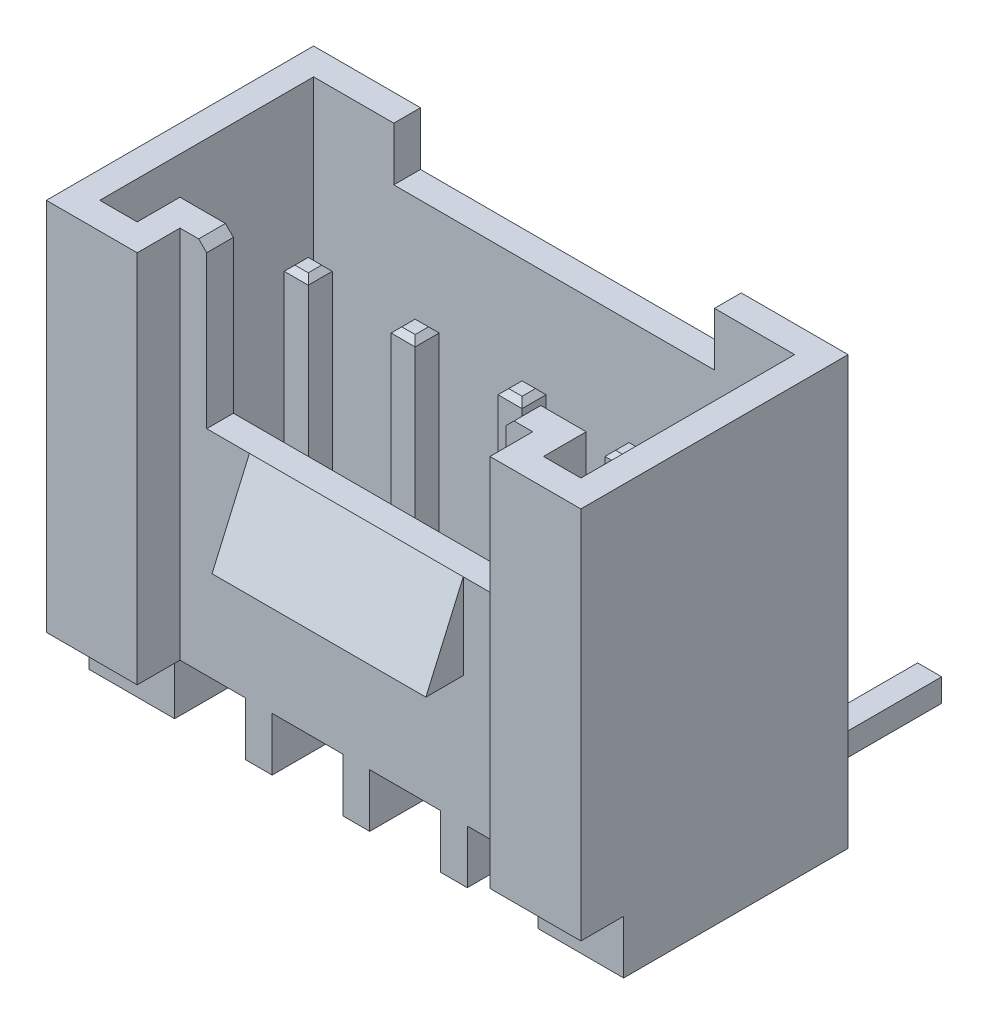
from build123d import *

# Parameters (mm, degrees)
ESQUISSE1_W             = 10
ESQUISSE1_H             = 5
BOSS_EXTRU_1_DEPTH      = 8
ESQUISSE2_W             = 6.6
ESQUISSE2_H             = 0.8
ENL_V_MAT_EXTRU_1_DEPTH = 8
ENL_V_MAT_EXTRU_2_DEPTH = 6.5
ESQUISSE5_W             = 6
ESQUISSE5_H             = 0.5
ENL_V_MAT_EXTRU_3_DEPTH = 1
ESQUISSE6_W             = 5.6
ESQUISSE6_H             = 0.5
ENL_V_MAT_EXTRU_4_DEPTH = 3
ESQUISSE7_W             = 0.8
ESQUISSE7_H             = 1
ENL_V_MAT_EXTRU_5_DEPTH = 10
ESQUISSE8_W             = 6.8
ESQUISSE8_H             = 4.2
ENL_V_MAT_EXTRU_6_DEPTH = 1
BOSS_EXTRU_2_DEPTH      = 6.8
BOSS_EXTRU_3_DEPTH      = 2
BOSS_EXTRU_3_DEPTH_BACK = 2
ESQUISSE12_W            = 0.5
ESQUISSE12_H            = 4.2
BOSS_EXTRU_4_DEPTH      = 1
CHANFREIN1_SIZE         = 0.15
BOSS_EXTRU_5_DEPTH      = 0.5
BOSS_EXTRU_5_DEPTH_BACK = 6.3
ESQUISSE13_W            = 0.45
ESQUISSE13_H            = 0.45
ESQUISSE14_W            = 0.45
ESQUISSE14_H            = 0.43
BOSS_EXTRU_6_DEPTH      = 5.5
CONG_1_R                = 0.1
CHANFREIN2_SIZE         = 0.1


with BuildPart() as part:
    # Esquisse1 → Boss.-Extru.1 (new body)
    with BuildSketch(Plane(origin=(0, 0, 0), x_dir=(1, 0, 0), z_dir=(0, 1, 0))):
        with Locations((5, 2.5)):
            Rectangle(ESQUISSE1_W, ESQUISSE1_H)
    extrude(amount=BOSS_EXTRU_1_DEPTH)

    # Esquisse2 → Enlèv. mat.-Extru.1 (cut)
    with BuildSketch(Plane(origin=(0, 8, 0), x_dir=(1, 0, 0), z_dir=(0, 1, 0))):
        with Locations((5, 0.4)):
            Rectangle(ESQUISSE2_W, ESQUISSE2_H)
    extrude(amount=-ENL_V_MAT_EXTRU_1_DEPTH, mode=Mode.SUBTRACT)

    # Esquisse4 → Enlèv. mat.-Extru.2 (cut)
    with BuildSketch(Plane(origin=(0, 8, 0), x_dir=(1, 0, 0), z_dir=(0, 1, 0))):
        Polygon((0.5, 0.5), (1.2, 0.5), (1.2, 1.3), (8.8, 1.3), (8.8, 0.5), (9.5, 0.5), (9.5, 4.5), (0.5, 4.5), align=None)
    extrude(amount=-ENL_V_MAT_EXTRU_2_DEPTH, mode=Mode.SUBTRACT)

    # Esquisse5 → Enlèv. mat.-Extru.3 (cut)
    with BuildSketch(Plane(origin=(0, 8, 0), x_dir=(1, 0, 0), z_dir=(0, 1, 0))):
        with Locations((5, 4.75)):
            Rectangle(ESQUISSE5_W, ESQUISSE5_H)
    extrude(amount=-ENL_V_MAT_EXTRU_3_DEPTH, mode=Mode.SUBTRACT)

    # Esquisse6 → Enlèv. mat.-Extru.4 (cut)
    with BuildSketch(Plane(origin=(0, 8, 0), x_dir=(1, 0, 0), z_dir=(0, 1, 0))):
        with Locations((5, 1.05)):
            Rectangle(ESQUISSE6_W, ESQUISSE6_H)
    extrude(amount=-ENL_V_MAT_EXTRU_4_DEPTH, mode=Mode.SUBTRACT)

    # Esquisse7 → Enlèv. mat.-Extru.5 (cut)
    with BuildSketch(Plane(origin=(10, 0, 0), x_dir=(0, 0, -1), z_dir=(1, 0, 0))):
        with Locations((0.4, 0.5)):
            Rectangle(ESQUISSE7_W, ESQUISSE7_H)
    extrude(amount=-ENL_V_MAT_EXTRU_5_DEPTH, mode=Mode.SUBTRACT)

    # Esquisse8 → Enlèv. mat.-Extru.6 (cut)
    with BuildSketch(Plane.XZ):
        with Locations((5, -2.9)):
            Rectangle(ESQUISSE8_W, ESQUISSE8_H)
    extrude(amount=-ENL_V_MAT_EXTRU_6_DEPTH, mode=Mode.SUBTRACT)

    # Esquisse9 → Boss.-Extru.2 (add)
    with BuildSketch(Plane(origin=(1.6, 0, 0), x_dir=(0, 0, -1), z_dir=(1, 0, 0))):
        Polygon((4.7, 1), (3.9, 0.2), (1.9, 0.2), (1.1, 1), align=None)
    extrude(amount=BOSS_EXTRU_2_DEPTH)

    # Esquisse11 → Boss.-Extru.3 (add, two sides: drawn at the far end of the back side and taken through both)
    with BuildSketch(Plane(origin=(5, 0, 0), x_dir=(0, 0, -1), z_dir=(1, 0, 0)).offset(-BOSS_EXTRU_3_DEPTH_BACK)):
        Polygon((0.8, 5), (0.1, 3.4), (0.8, 3.4), align=None)
    extrude(amount=BOSS_EXTRU_3_DEPTH + BOSS_EXTRU_3_DEPTH_BACK)

    # Esquisse12 → Boss.-Extru.4 (add)
    with BuildSketch(Plane(origin=(0, 1, 0), x_dir=(1, 0, 0), z_dir=(0, 1, 0))):
        with Locations((5, 2.9)):
            Rectangle(ESQUISSE12_W, ESQUISSE12_H)
        with Locations((3.175, 2.9)):
            Rectangle(ESQUISSE12_W, ESQUISSE12_H)
        with Locations((6.825, 2.9)):
            Rectangle(ESQUISSE12_W, ESQUISSE12_H)
    extrude(amount=-BOSS_EXTRU_4_DEPTH)

    # Chanfrein1
    chanfrein1_edges = [part.edges().sort_by_distance(p)[0] for p in [
        (2.2, 8, -1.05),
        (7.8, 8, -1.05),
    ]]
    chamfer(chanfrein1_edges, length=CHANFREIN1_SIZE)

    # Esquisse13 → Boss.-Extru.5 (add, two sides: drawn at the far end of the back side and taken through both)
    with BuildSketch(Plane.XZ.offset(-0.2).offset(-BOSS_EXTRU_5_DEPTH_BACK)):
        with Locations((4, -2.9)):
            Rectangle(ESQUISSE13_W, ESQUISSE13_H)
        with Locations((2, -2.9)):
            Rectangle(ESQUISSE13_W, ESQUISSE13_H)
        with Locations((8, -2.9)):
            Rectangle(ESQUISSE13_W, ESQUISSE13_H)
        with Locations((6, -2.9)):
            Rectangle(ESQUISSE13_W, ESQUISSE13_H)
    extrude(amount=BOSS_EXTRU_5_DEPTH + BOSS_EXTRU_5_DEPTH_BACK)

    # Esquisse14 → Boss.-Extru.6 (add)
    with BuildSketch(Plane(origin=(0, 0, -3.125), x_dir=(-1, 0, 0), z_dir=(0, 0, -1))):
        with Locations((-8, -0.085)):
            Rectangle(ESQUISSE14_W, ESQUISSE14_H)
        with Locations((-6, -0.085)):
            Rectangle(ESQUISSE14_W, ESQUISSE14_H)
        with Locations((-4, -0.085)):
            Rectangle(ESQUISSE14_W, ESQUISSE14_H)
        with Locations((-2, -0.085)):
            Rectangle(ESQUISSE14_W, ESQUISSE14_H)
    extrude(amount=BOSS_EXTRU_6_DEPTH)

    # Congé1
    # the kernel refuses this fillet: 0.1 mm, written as the material it adds along each edge
    with BuildSketch(Plane(origin=(7.775, 0.13, -3.125), x_dir=(0, 1, 0), z_dir=(1, 0, 0)), Plane(origin=(5.775, 0.13, -3.125), x_dir=(0, 1, 0), z_dir=(1, 0, 0))) as cong_1_piece_1:
        with BuildLine():
            CenterArc((0.1, -0.09539392), CONG_1_R, 107.457603124, 72.542396876)
            Line((0, -0.09539392), (0, 0))
            Line((0, 0), (0.07, 0))
        make_face()
    extrude(amount=0.45)
    with BuildSketch(Plane(origin=(3.775, 0.13, -3.125), x_dir=(0, 0, -1), z_dir=(1, 0, 0)), Plane(origin=(1.775, 0.13, -3.125), x_dir=(0, 0, -1), z_dir=(1, 0, 0))) as cong_1_piece_2:
        with BuildLine():
            CenterArc((0.09539392, 0.1), CONG_1_R, 197.457603124, 72.542396876)
            Line((0, 0.07), (0, 0))
            Line((0, 0), (0.09539392, 0))
        make_face()
    extrude(amount=0.45)
    # the kernel refuses this fillet: 0.1 mm, written as the material it takes off along each edge
    with BuildSketch(Plane(origin=(3.525, -0.3, -2.675), x_dir=(0, 1, 0), z_dir=(1, 0, 0)), Plane(origin=(1.525, -0.3, -2.675), x_dir=(0, 1, 0), z_dir=(1, 0, 0))) as cong_1_2_piece_1:
        with BuildLine():
            CenterArc((CONG_1_R, -CONG_1_R), CONG_1_R, 90, 90)
            Line((0, -CONG_1_R), (0, 0))
            Line((0, 0), (CONG_1_R, 0))
        make_face()
    extrude(amount=0.95, mode=Mode.SUBTRACT)
    with BuildSketch(Plane(origin=(8.475, -0.3, -2.675), x_dir=(0, 1, 0), z_dir=(-1, 0, 0)), Plane(origin=(6.475, -0.3, -2.675), x_dir=(0, 1, 0), z_dir=(-1, 0, 0))) as cong_1_2_piece_2:
        with BuildLine():
            CenterArc((CONG_1_R, CONG_1_R), CONG_1_R, 180, 90)
            Line((0, CONG_1_R), (0, 0))
            Line((0, 0), (CONG_1_R, 0))
        make_face()
    extrude(amount=0.95, mode=Mode.SUBTRACT)

    # Chanfrein2
    chanfrein2_edges = [part.edges().sort_by_distance(p)[0] for p in [
        (4.225, 6.5, -2.9),
        (4, 6.5, -3.125),
        (3.775, 6.5, -2.9),
        (4, 6.5, -2.675),
        (2.225, 6.5, -2.9),
        (2, 6.5, -3.125),
        (1.775, 6.5, -2.9),
        (2, 6.5, -2.675),
        (7.775, 6.5, -2.9),
        (8, 6.5, -2.675),
        (8.225, 6.5, -2.9),
        (8, 6.5, -3.125),
        (5.775, 6.5, -2.9),
        (6, 6.5, -2.675),
        (6.225, 6.5, -2.9),
        (6, 6.5, -3.125),
        (8.225, -0.085, -8.625),
        (8, -0.3, -8.625),
        (7.775, -0.085, -8.625),
        (8, 0.13, -8.625),
        (6.225, -0.085, -8.625),
        (6, -0.3, -8.625),
        (5.775, -0.085, -8.625),
        (6, 0.13, -8.625),
        (4.225, -0.085, -8.625),
        (4, -0.3, -8.625),
        (3.775, -0.085, -8.625),
        (4, 0.13, -8.625),
        (2.225, -0.085, -8.625),
        (2, -0.3, -8.625),
        (1.775, -0.085, -8.625),
        (2, 0.13, -8.625),
    ]]
    chamfer(chanfrein2_edges, length=CHANFREIN2_SIZE)


solid = part.part
